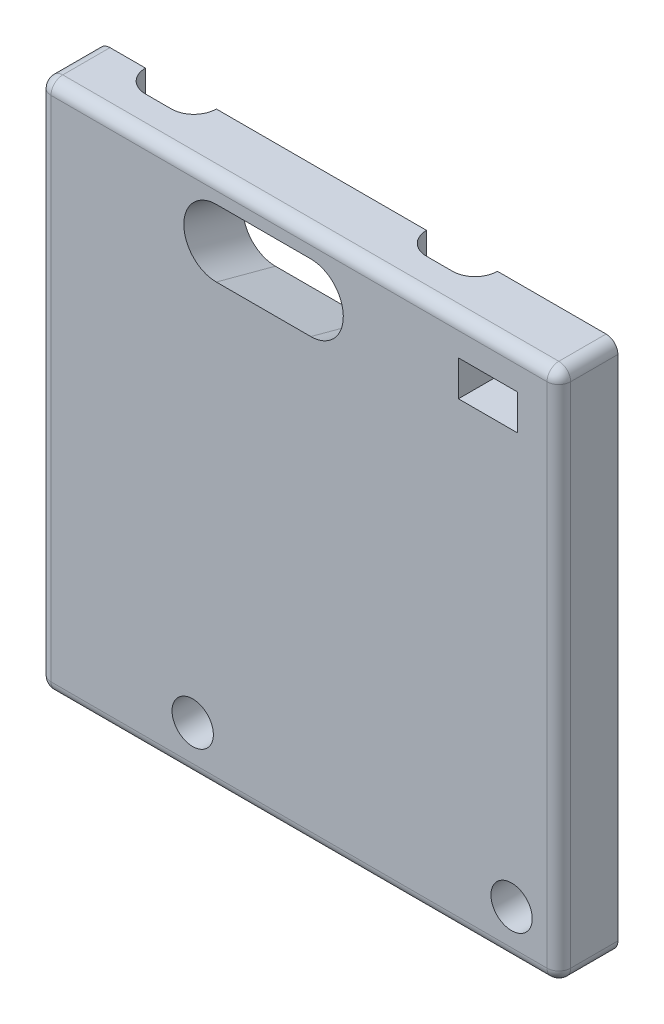
from build123d import *

# Parameters (mm, degrees)
SKETCH1_W                       = 44
SKETCH1_H                       = 45
BASE_DEPTH                      = 5
WIRE_GROOVES_DEPTH              = 51.338851795
SCREW_INSERTION_HOLE_DEPTH      = 33.181634738
SCREW_INSERTION_HOLE_DEPTH_BACK = 33.181634738
SKETCH5_W                       = 5
SKETCH5_H                       = 3
ZIP_TIE_SLOTS_DEPTH             = 32.862987933
SKETCH6_R                       = 1.75
MOUNT_CLAMPING_HOLES_DEPTH      = 32.862987933
EDGE_FILLETS_R                  = 1


with BuildPart() as part:
    # Sketch1 → Base (new body)
    with BuildSketch(Plane.XY):
        Rectangle(SKETCH1_W, SKETCH1_H)
    extrude(amount=BASE_DEPTH)

    # Sketch2 → Wire Grooves (cut, through all)
    with BuildSketch(Plane(origin=(0, 22.5, 0), x_dir=(1, 0, 0), z_dir=(0, 1, 0))):
        with BuildLine():
            Line((-18, 0), (-12, 0))
            ThreePointArc((-12, 0), (-12.556497116, -1.343502884), (-13.9, -1.9))
            Line((-13.9, -1.9), (-16.1, -1.9))
            ThreePointArc((-16.1, -1.9), (-17.443502884, -1.343502884), (-18, 0))
        make_face()
        with BuildLine():
            Line((9.9, -1.9), (7.7, -1.9))
            ThreePointArc((7.7, -1.9), (6.356497116, -1.343502884), (5.8, 0))
            Line((5.8, 0), (11.8, 0))
            ThreePointArc((11.8, 0), (11.243502884, -1.343502884), (9.9, -1.9))
        make_face()
    extrude(amount=-WIRE_GROOVES_DEPTH, mode=Mode.SUBTRACT)

    # Sketch3 → Screw Insertion Hole (cut, two sides: drawn at the far end of the back side and taken through both)
    with BuildSketch(Plane(origin=(0, 0.596130014, 4.269237963), x_dir=(-1, 0, 0), z_dir=(0, -0.25881904510252135, -0.9659258262890681)).offset(-SCREW_INSERTION_HOLE_DEPTH_BACK)):
        with BuildLine():
            Line((-1, 19.042473808), (7, 19.042473808))
            ThreePointArc((7, 19.042473808), (9.75, 16.292473808), (7, 13.542473808))
            Line((7, 13.542473808), (-1, 13.542473808))
            ThreePointArc((-1, 13.542473808), (-3.75, 16.292473808), (-1, 19.042473808))
        make_face()
    extrude(amount=SCREW_INSERTION_HOLE_DEPTH + SCREW_INSERTION_HOLE_DEPTH_BACK, mode=Mode.SUBTRACT)

    # Sketch5 → Zip Tie Slots (cut, through all)
    with BuildSketch(Plane(origin=(0, 0, 0), x_dir=(-1, 0, 0), z_dir=(0, 0, -1))):
        with Locations((-16, 18)):
            Rectangle(SKETCH5_W, SKETCH5_H)
    extrude(amount=-ZIP_TIE_SLOTS_DEPTH, mode=Mode.SUBTRACT)

    # Sketch6 → Mount Clamping Holes (cut, through all)
    with BuildSketch(Plane(origin=(0, 0, 0), x_dir=(-1, 0, 0), z_dir=(0, 0, -1))):
        with Locations((-18, -18.5)):
            Circle(SKETCH6_R)
        with Locations((9, -18.5)):
            Circle(SKETCH6_R)
    extrude(amount=-MOUNT_CLAMPING_HOLES_DEPTH, mode=Mode.SUBTRACT)

    # Edge Fillets
    edge_fillets_edges = [part.edges().sort_by_distance(p)[0] for p in [
        (-22, 0, 5),
        (22, 0, 5),
        (0, -22.5, 5),
        (0, 22.5, 5),
        (22, 22.5, 2.5),
        (22, -22.5, 2.5),
        (-22, -22.5, 2.5),
        (-22, 22.5, 2.5),
    ]]
    fillet(edge_fillets_edges, radius=EDGE_FILLETS_R)


solid = part.part
